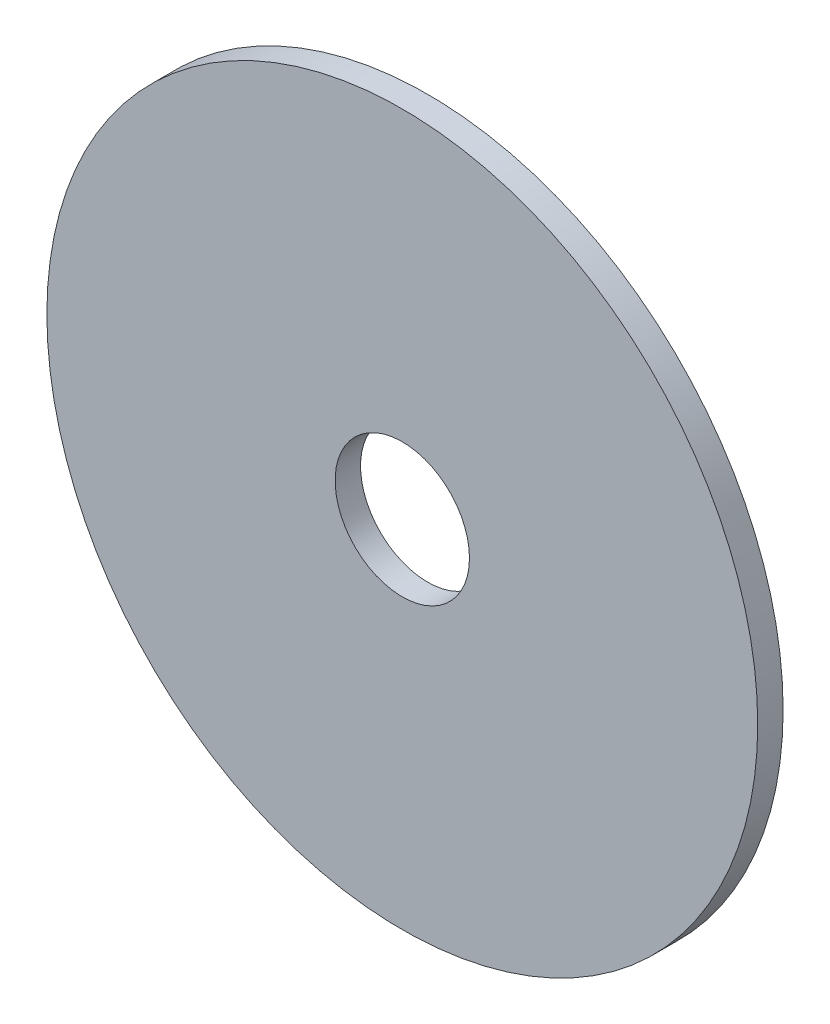
from build123d import *

# Parameters (mm, degrees)
SKETCH3_R           = 22.225
SKETCH3_R_2         = 4.2
BOSS_EXTRUDE1_DEPTH = 1.5875


with BuildPart() as part:
    # Sketch3 → Boss-Extrude1 (new body)
    with BuildSketch(Plane.XY):
        Circle(SKETCH3_R)
        Circle(SKETCH3_R_2, mode=Mode.SUBTRACT)
    extrude(amount=BOSS_EXTRUDE1_DEPTH)


solid = part.part
